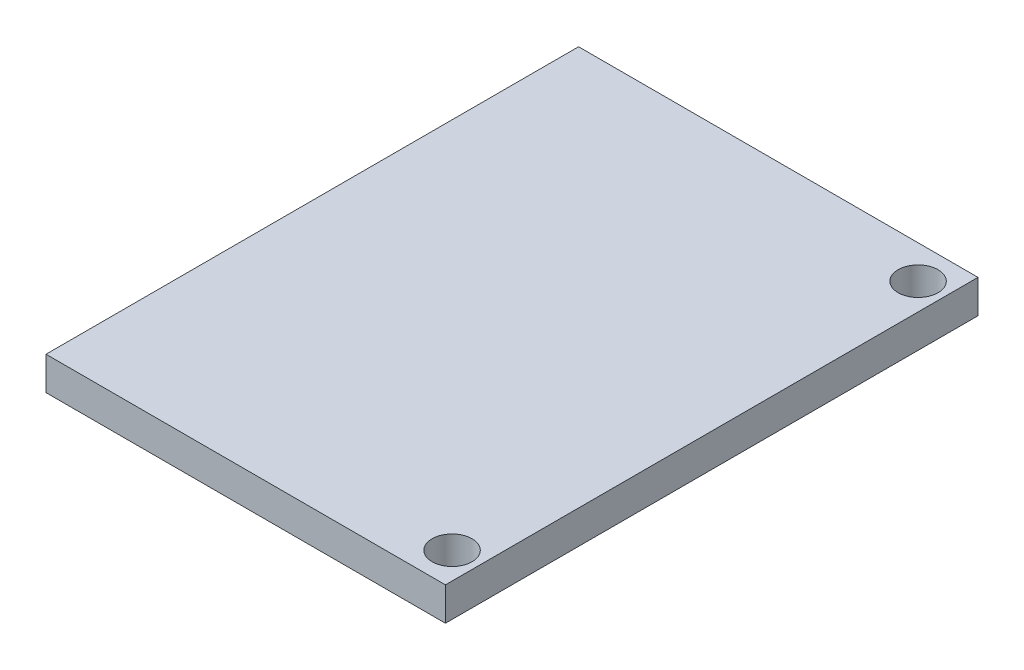
from build123d import *

# Parameters (mm, degrees)
SKETCH1_W           = 76.2
SKETCH1_H           = 101.6
BOSS_EXTRUDE1_DEPTH = 6.35
SKETCH2_R           = 3.81
CUT_EXTRUDE1_DEPTH  = 128.158650905


with BuildPart() as part:
    # Sketch1 → Boss-Extrude1 (new body)
    with BuildSketch(Plane(origin=(0, 0, 0), x_dir=(1, 0, 0), z_dir=(0, 1, 0))):
        with Locations((38.1, 50.8)):
            Rectangle(SKETCH1_W, SKETCH1_H)
    extrude(amount=BOSS_EXTRUDE1_DEPTH)

    # Sketch2 → Cut-Extrude1 (cut, through all)
    with BuildSketch(Plane(origin=(0, 6.35, 0), x_dir=(1, 0, 0), z_dir=(0, 1, 0))):
        with Locations((71.12, 95.25)):
            Circle(SKETCH2_R)
        with Locations((71.12, 6.35)):
            Circle(SKETCH2_R)
    extrude(amount=-CUT_EXTRUDE1_DEPTH, mode=Mode.SUBTRACT)


solid = part.part
